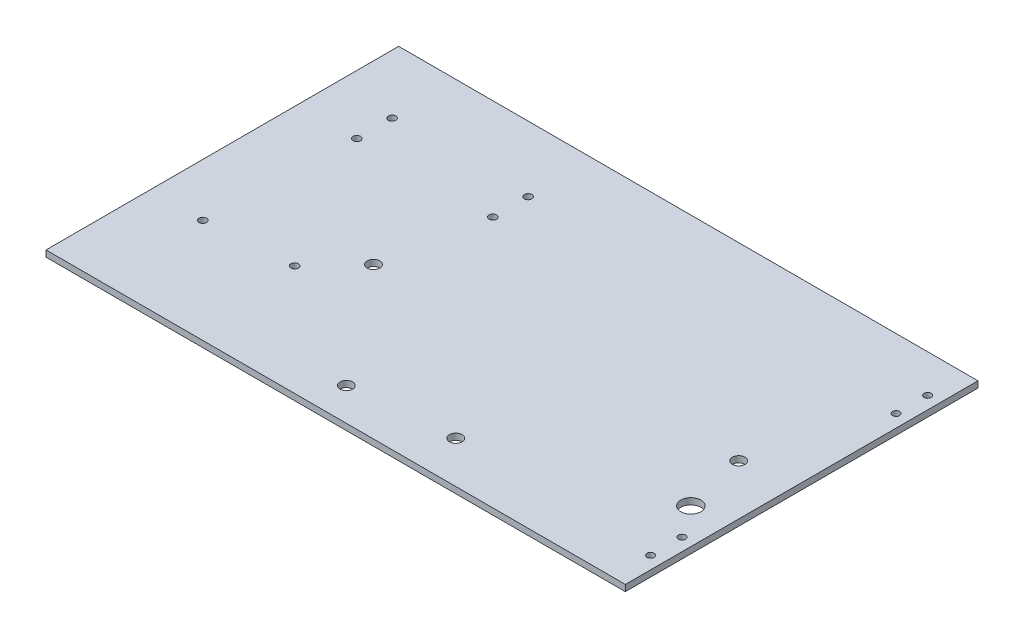
from build123d import *

# Parameters (mm, degrees)
SKETCH1_W           = 317.5
SKETCH1_H           = 177.8
SKETCH1_R           = 3.175
SKETCH1_R_2         = 1.905
BOSS_EXTRUDE1_DEPTH = 3.175
SKETCH2_R           = 1.905
CUT_EXTRUDE1_DEPTH  = 182.974869488
SKETCH3_R           = 3.175
CUT_EXTRUDE2_DEPTH  = 182.974869488
SKETCH4_W           = 25.4
SKETCH4_H           = 177.8
CUT_EXTRUDE3_DEPTH  = 182.974869488
SKETCH5_R           = 5.08
CUT_EXTRUDE4_DEPTH  = 182.974869488
SKETCH6_R           = 1.8034
CUT_EXTRUDE5_DEPTH  = 182.974869488


with BuildPart() as part:
    # Sketch1 → Boss-Extrude1 (new body)
    with BuildSketch(Plane(origin=(0, 0, 0), x_dir=(1, 0, 0), z_dir=(0, 1, 0))):
        Rectangle(SKETCH1_W, SKETCH1_H)
        with Locations((-69.85, -12.7)):
            Circle(SKETCH1_R, mode=Mode.SUBTRACT)
        with Locations((107.95, -6.35)):
            Circle(SKETCH1_R, mode=Mode.SUBTRACT)
        with Locations((-129.032, 55.88)):
            Circle(SKETCH1_R_2, mode=Mode.SUBTRACT)
        with Locations((-60.452, 55.88)):
            Circle(SKETCH1_R_2, mode=Mode.SUBTRACT)
        with Locations((-129.032, 38.1)):
            Circle(SKETCH1_R_2, mode=Mode.SUBTRACT)
        with Locations((-60.452, 38.1)):
            Circle(SKETCH1_R_2, mode=Mode.SUBTRACT)
    extrude(amount=BOSS_EXTRUDE1_DEPTH)

    # Sketch2 → Cut-Extrude1 (cut, through all)
    with BuildSketch(Plane(origin=(0, 3.175, 0), x_dir=(1, 0, 0), z_dir=(0, 1, 0))):
        with Locations((-89.08170041, -33.177029855)):
            Circle(SKETCH2_R)
        with Locations((-132.137607944, -36.44830276)):
            Circle(SKETCH2_R)
    extrude(amount=-CUT_EXTRUDE1_DEPTH, mode=Mode.SUBTRACT)

    # Sketch3 → Cut-Extrude2 (cut, through all)
    with BuildSketch(Plane(origin=(0, 0, 0), x_dir=(-1, 0, 0), z_dir=(0, -1, 0))):
        with Locations((23.829539609, -72.39)):
            Circle(SKETCH3_R)
        with Locations((-26.764302072, -67.818)):
            Circle(SKETCH3_R)
    extrude(amount=-CUT_EXTRUDE2_DEPTH, mode=Mode.SUBTRACT)

    # Sketch4 → Cut-Extrude3 (cut, through all)
    with BuildSketch(Plane(origin=(0, 3.175, 0), x_dir=(1, 0, 0), z_dir=(0, 1, 0))):
        with Locations((146.05, 0)):
            Rectangle(SKETCH4_W, SKETCH4_H)
    extrude(amount=-CUT_EXTRUDE3_DEPTH, mode=Mode.SUBTRACT)

    # Sketch5 → Cut-Extrude4 (cut, through all)
    with BuildSketch(Plane(origin=(0, 3.175, 0), x_dir=(1, 0, 0), z_dir=(0, 1, 0))):
        with Locations((115.57, -38.1)):
            Circle(SKETCH5_R)
    extrude(amount=-CUT_EXTRUDE4_DEPTH, mode=Mode.SUBTRACT)

    # Sketch6 → Cut-Extrude5 (cut, through all)
    with BuildSketch(Plane.XZ):
        with Locations((127, 69.85)):
            Circle(SKETCH6_R)
        with Locations((127, 53.975)):
            Circle(SKETCH6_R)
        with Locations((127, -53.975)):
            Circle(SKETCH6_R)
        with Locations((127, -69.85)):
            Circle(SKETCH6_R)
    extrude(amount=-CUT_EXTRUDE5_DEPTH, mode=Mode.SUBTRACT)


solid = part.part
